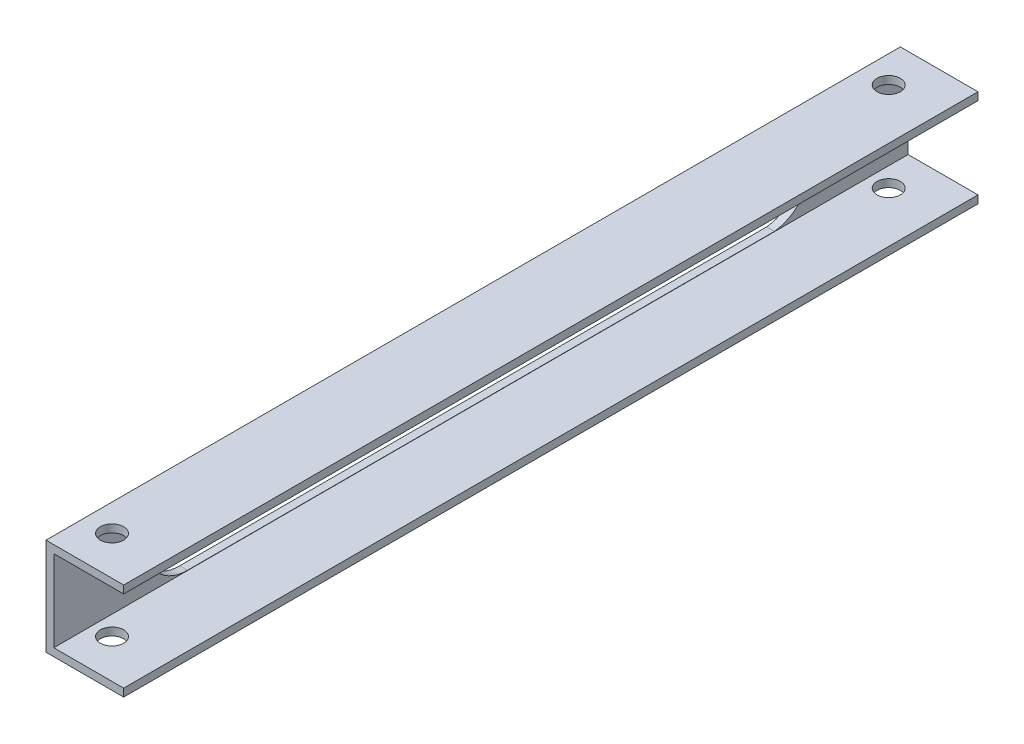
from build123d import *

# Parameters (mm, degrees)
BOSS_EXTRUDE1_DEPTH = 220
CUT_EXTRUDE1_REACH  = 335.719
SKETCH3_R           = 3
CUT_EXTRUDE2_DEPTH  = 220


with BuildPart() as part:
    # Sketch1 → Boss-Extrude1 (new body)
    with BuildSketch(Plane.XY):
        Polygon((-157.703422053, 227.136882129), (-157.703422053, 225.136882129), (-177.703422053, 225.136882129), (-177.703422053, 250.136882129), (-157.703422053, 250.136882129), (-157.703422053, 248.136882129), (-175.703422053, 248.136882129), (-175.703422053, 227.136882129), align=None)
    extrude(amount=BOSS_EXTRUDE1_DEPTH)

    # Sketch2 → Cut-Extrude1 (cut, up to next)
    with BuildSketch(Plane.ZY.offset(177.703422053), mode=Mode.PRIVATE) as cut_extrude1_sk1:
        with BuildLine():
            Line((34.406705906, 248.069619472), (185.593294094, 248.069619472))
            ThreePointArc((185.593294094, 248.069619472), (196.026031437, 237.636882129), (185.593294094, 227.204144786))
            Line((185.593294094, 227.204144786), (34.406705906, 227.204144786))
            ThreePointArc((34.406705906, 227.204144786), (25.093294094, 237.636882129), (34.406705906, 248.069619472))
        make_face()
    cut_extrude1_tool1 = extrude(cut_extrude1_sk1.sketch, amount=-CUT_EXTRUDE1_REACH, mode=Mode.PRIVATE) & part.part
    add(cut_extrude1_tool1.solids().sort_by_distance((-177.703422, 237.636882, 110.543615))[0], mode=Mode.SUBTRACT)

    # Sketch3 → Cut-Extrude2 (cut)
    with BuildSketch(Plane(origin=(0, 250.136882129, 0), x_dir=(1, 0, 0), z_dir=(0, 1, 0))):
        with Locations((-170.703422053, -210)):
            Circle(SKETCH3_R)
        with Locations((-170.703422053, -10)):
            Circle(SKETCH3_R)
    extrude(amount=-CUT_EXTRUDE2_DEPTH, mode=Mode.SUBTRACT)


solid = part.part
